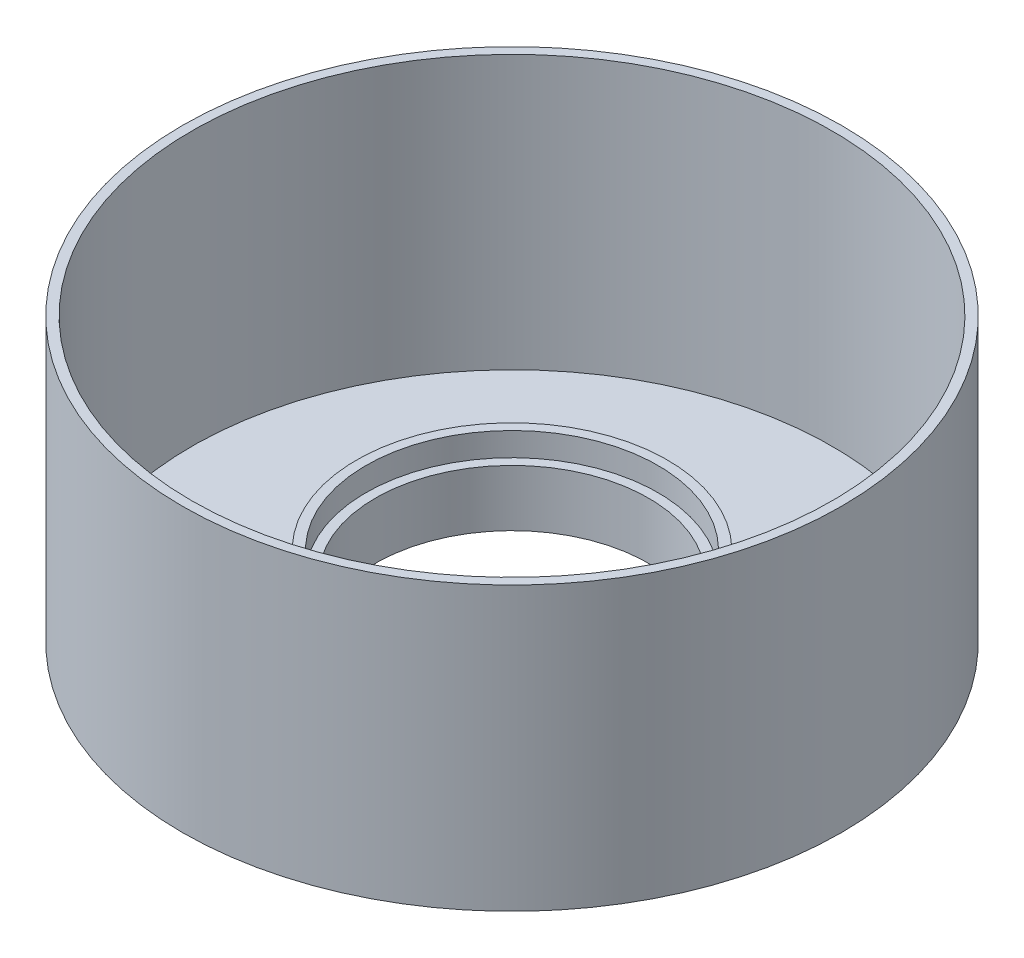
from build123d import *

# Parameters (mm, degrees)
SKETCH1_R           = 70
BOSS_EXTRUDE1_DEPTH = 60
SHELL1_T            = -2
SKETCH2_R           = 33
SKETCH2_R_2         = 29
EXTRUDE_THIN1_DEPTH = 15
SKETCH3_R           = 31
CUT_EXTRUDE1_DEPTH  = 5
CUT_EXTRUDE2_START  = -2
SKETCH4_R           = 29
CUT_EXTRUDE2_DEPTH  = 2


with BuildPart() as part:
    # Sketch1 → Boss-Extrude1 (new body)
    with BuildSketch(Plane(origin=(0, 0, 0), x_dir=(1, 0, 0), z_dir=(0, 1, 0))):
        Circle(SKETCH1_R)
    extrude(amount=BOSS_EXTRUDE1_DEPTH)

    # Shell1
    shell1_openings = [part.faces().sort_by_distance(p)[0] for p in [
        (0, 60, 0),
    ]]
    offset(amount=SHELL1_T, openings=shell1_openings, kind=Kind.INTERSECTION)

    # Sketch2 → Extrude-Thin1 (add)
    with BuildSketch(Plane(origin=(0, 2, 0), x_dir=(1, 0, 0), z_dir=(0, 1, 0))):
        Circle(SKETCH2_R)
        Circle(SKETCH2_R_2, mode=Mode.SUBTRACT)
    extrude(amount=EXTRUDE_THIN1_DEPTH)

    # Sketch3 → Cut-Extrude1 (cut)
    with BuildSketch(Plane(origin=(0, 17, 0), x_dir=(1, 0, 0), z_dir=(0, 1, 0))):
        Circle(SKETCH3_R)
    extrude(amount=-CUT_EXTRUDE1_DEPTH, mode=Mode.SUBTRACT)

    # Sketch4 → Cut-Extrude2 (cut)
    with BuildSketch(Plane(origin=(0, 2, 0), x_dir=(1, 0, 0), z_dir=(0, 1, 0)).offset(CUT_EXTRUDE2_START)):
        Circle(SKETCH4_R)
    extrude(amount=CUT_EXTRUDE2_DEPTH, mode=Mode.SUBTRACT)


solid = part.part
